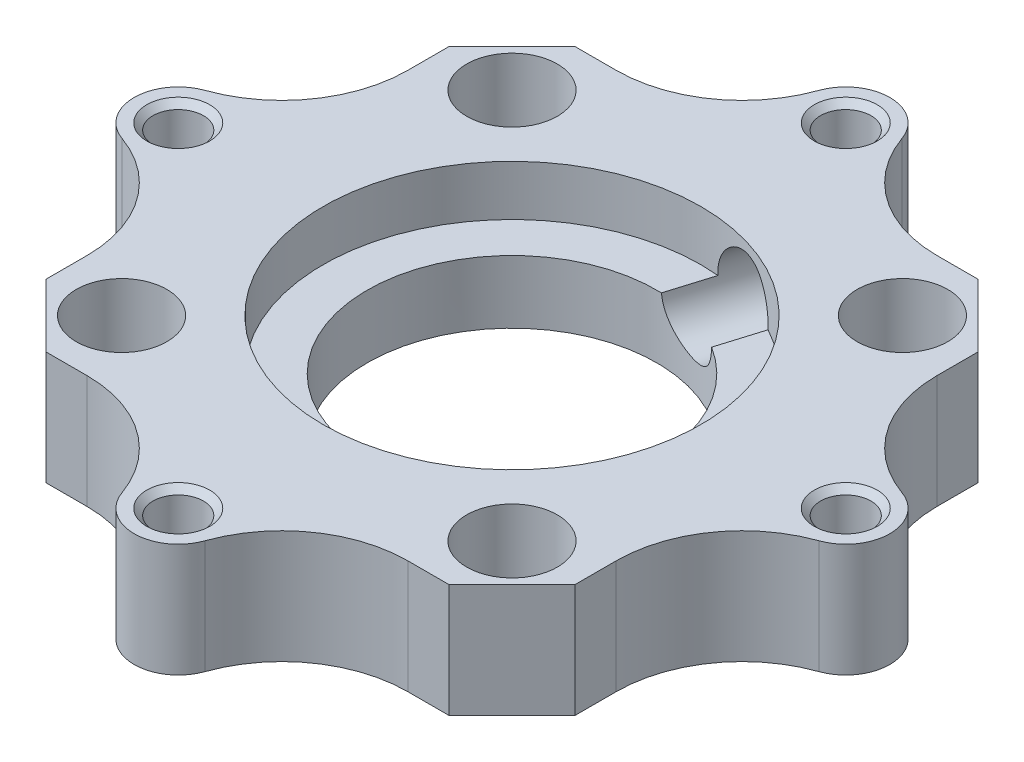
from build123d import *

# Parameters (mm, degrees)
SKETCH1_W               = 60
SKETCH1_H               = 60
SKETCH1_R               = 11.5
BOSS_EXTRUDE1_DEPTH     = 5
CUT_EXTRUDE1_DEPTH      = 10
SKETCH3_R               = 3.6
CUT_EXTRUDE2_DEPTH      = 3
SKETCH4_R               = 1.6
CUT_EXTRUDE3_DEPTH      = 3
SKETCH5_R               = 2
CUT_EXTRUDE4_DEPTH      = 43.720018727
CUT_EXTRUDE5_DEPTH      = 43.720018727
CHAMFER1_SIZE           = 5
FILLET1_R               = 10
BOSS_EXTRUDE2_START     = 4
SKETCH7_R               = 2
SKETCH7_R_2             = 3.6
SKETCH7_R_3             = 11.5
BOSS_EXTRUDE2_DEPTH     = 4
SKETCH8_R               = 15
CUT_EXTRUDE6_DEPTH      = 4
CUT_EXTRUDE7_DEPTH      = 10
CUT_EXTRUDE7_DEPTH_BACK = 16
SKETCH10_R              = 3
CHAMFER2_SIZE           = 0.5


with BuildPart() as part:
    # Sketch1 → Boss-Extrude1 (new body)
    with BuildSketch(Plane(origin=(0, 0, 0), x_dir=(1, 0, 0), z_dir=(0, 1, 0))):
        Rectangle(SKETCH1_W, SKETCH1_H)
        Circle(SKETCH1_R, mode=Mode.SUBTRACT)
    extrude(amount=BOSS_EXTRUDE1_DEPTH)

    # Sketch2 → Cut-Extrude1 (cut)
    with BuildSketch(Plane(origin=(0, 5, 0), x_dir=(1, 0, 0), z_dir=(0, 1, 0))):
        with BuildLine():
            Line((0, -30), (30, -30))
            Line((30, -30), (30, 0))
            ThreePointArc((30, 0), (21.213203436, -21.213203436), (0, -30))
        make_face()
        with BuildLine():
            Line((-30, -30), (0, -30))
            ThreePointArc((0, -30), (-21.213203436, -21.213203436), (-30, 0))
            Line((-30, 0), (-30, -30))
        make_face()
        with BuildLine():
            ThreePointArc((4.3e-08, 30), (21.213203451, 21.21320342), (30, 0))
            Line((30, 0), (30, 30))
            Line((30, 30), (4.3e-08, 30))
        make_face()
        with BuildLine():
            Line((-30, 30), (-30, 0))
            ThreePointArc((-30, 0), (-21.21320342, 21.213203451), (4.3e-08, 30))
            Line((4.3e-08, 30), (-30, 30))
        make_face()
    extrude(amount=-CUT_EXTRUDE1_DEPTH, mode=Mode.SUBTRACT)

    # Sketch3 → Cut-Extrude2 (cut)
    with BuildSketch(Plane(origin=(0, 5, 0), x_dir=(1, 0, 0), z_dir=(0, 1, 0))):
        with Locations((-15.5, 15.5)):
            Circle(SKETCH3_R)
        with Locations((15.5, 15.5)):
            Circle(SKETCH3_R)
        with Locations((15.5, -15.5)):
            Circle(SKETCH3_R)
        with Locations((-15.5, -15.5)):
            Circle(SKETCH3_R)
    extrude(amount=-CUT_EXTRUDE2_DEPTH, mode=Mode.SUBTRACT)

    # Sketch4 → Cut-Extrude3 (cut)
    with BuildSketch(Plane(origin=(0, 2, 0), x_dir=(1, 0, 0), z_dir=(0, 1, 0))):
        with Locations((-15.5, 15.5)):
            Circle(SKETCH4_R)
        with Locations((15.5, 15.5)):
            Circle(SKETCH4_R)
        with Locations((15.5, -15.5)):
            Circle(SKETCH4_R)
        with Locations((-15.5, -15.5)):
            Circle(SKETCH4_R)
    extrude(amount=-CUT_EXTRUDE3_DEPTH, mode=Mode.SUBTRACT)

    # Sketch5 → Cut-Extrude4 (cut, through all)
    with BuildSketch(Plane(origin=(0, 5, 0), x_dir=(1, 0, 0), z_dir=(0, 1, 0))):
        with Locations((-26.5, 0)):
            Circle(SKETCH5_R)
        with Locations((0, 26.5)):
            Circle(SKETCH5_R)
        with Locations((26.5, 0)):
            Circle(SKETCH5_R)
        with Locations((0, -26.5)):
            Circle(SKETCH5_R)
    extrude(amount=-CUT_EXTRUDE4_DEPTH, mode=Mode.SUBTRACT)

    # Sketch6 → Cut-Extrude5 (cut, through all)
    with BuildSketch(Plane(origin=(0, 5, 0), x_dir=(1, 0, 0), z_dir=(0, 1, 0))):
        with BuildLine():
            Line((3.5, 26.5), (3.5, 21))
            Line((3.5, 21), (21, 21))
            Line((21, 21), (21, 3.5))
            Line((21, 3.5), (26.5, 3.5))
            ThreePointArc((26.5, 3.5), (28.974873734, 2.474873734), (30, 0))
            ThreePointArc((30, 0), (21.213203434, 21.213203438), (-5e-09, 30))
            ThreePointArc((-5e-09, 30), (2.474873732, 28.974873736), (3.5, 26.5))
        make_face()
        with BuildLine():
            ThreePointArc((-3.5, 26.5), (-2.474873736, 28.974873732), (-5e-09, 30))
            ThreePointArc((-5e-09, 30), (-21.213203437, 21.213203434), (-30, 1e-09))
            ThreePointArc((-30, 1e-09), (-28.974873734, 2.474873735), (-26.5, 3.5))
            Line((-26.5, 3.5), (-21, 3.5))
            Line((-21, 3.5), (-21, 21))
            Line((-21, 21), (-3.5, 21))
            Line((-3.5, 21), (-3.5, 26.5))
        make_face()
        with BuildLine():
            ThreePointArc((0, -30), (21.213203436, -21.213203436), (30, 0))
            ThreePointArc((30, 0), (28.974873734, -2.474873734), (26.5, -3.5))
            Line((26.5, -3.5), (21, -3.5))
            Line((21, -3.5), (21, -21))
            Line((21, -21), (3.5, -21))
            Line((3.5, -21), (3.5, -26.5))
            ThreePointArc((3.5, -26.5), (2.474873734, -28.974873734), (0, -30))
        make_face()
        with BuildLine():
            ThreePointArc((-26.5, -3.5), (-28.974873735, -2.474873734), (-30, 1e-09))
            ThreePointArc((-30, 1e-09), (-21.213203436, -21.213203435), (0, -30))
            ThreePointArc((0, -30), (-2.474873734, -28.974873734), (-3.5, -26.5))
            Line((-3.5, -26.5), (-3.5, -21))
            Line((-3.5, -21), (-21, -21))
            Line((-21, -21), (-21, -3.5))
            Line((-21, -3.5), (-26.5, -3.5))
        make_face()
    extrude(amount=-CUT_EXTRUDE5_DEPTH, mode=Mode.SUBTRACT)

    # Chamfer1
    chamfer1_edges = [part.edges().sort_by_distance(p)[0] for p in [
        (-21, 2.5, -21),
        (-21, 2.5, 21),
        (21, 2.5, 21),
        (21, 2.5, -21),
    ]]
    chamfer(chamfer1_edges, length=CHAMFER1_SIZE)

    # Fillet1
    fillet1_edges = [part.edges().sort_by_distance(p)[0] for p in [
        (3.5, 2.5, -21),
        (-3.5, 2.5, -21),
        (-21, 2.5, -3.5),
        (-21, 2.5, 3.5),
        (-3.5, 2.5, 21),
        (3.5, 2.5, 21),
        (21, 2.5, 3.5),
        (21, 2.5, -3.5),
    ]]
    fillet(fillet1_edges, radius=FILLET1_R)

    # Sketch7 → Boss-Extrude2 (add)
    with BuildSketch(Plane(origin=(0, 5, 0), x_dir=(1, 0, 0), z_dir=(0, 1, 0)).offset(BOSS_EXTRUDE2_START)):
        with BuildLine():
            Line((-21, -12.727922061), (-21, -16))
            Line((-21, -16), (-16, -21))
            Line((-16, -21), (-12.727922061, -21))
            ThreePointArc((-12.727922061, -21), (-6.954419369, -22.835034191), (-3.299831646, -27.666666667))
            ThreePointArc((-3.299831646, -27.666666667), (0, -30), (3.299831646, -27.666666667))
            ThreePointArc((3.299831646, -27.666666667), (6.954419369, -22.835034191), (12.727922061, -21))
            Line((12.727922061, -21), (16, -21))
            Line((16, -21), (21, -16))
            Line((21, -16), (21, -12.727922061))
            ThreePointArc((21, -12.727922061), (22.835034191, -6.954419369), (27.666666667, -3.299831646))
            ThreePointArc((27.666666667, -3.299831646), (30, 0), (27.666666667, 3.299831646))
            ThreePointArc((27.666666667, 3.299831646), (22.835034191, 6.954419369), (21, 12.727922061))
            Line((21, 12.727922061), (21, 16))
            Line((21, 16), (16, 21))
            Line((16, 21), (12.727922061, 21))
            ThreePointArc((12.727922061, 21), (6.954419369, 22.835034191), (3.299831646, 27.666666667))
            ThreePointArc((3.299831646, 27.666666667), (0, 30), (-3.299831646, 27.666666667))
            ThreePointArc((-3.299831646, 27.666666667), (-6.954419369, 22.835034191), (-12.727922061, 21))
            Line((-12.727922061, 21), (-16, 21))
            Line((-16, 21), (-21, 16))
            Line((-21, 16), (-21, 12.727922061))
            ThreePointArc((-21, 12.727922061), (-22.835034191, 6.954419369), (-27.666666667, 3.299831646))
            ThreePointArc((-27.666666667, 3.299831646), (-30, 0), (-27.666666667, -3.299831646))
            ThreePointArc((-27.666666667, -3.299831646), (-22.835034191, -6.954419369), (-21, -12.727922061))
        make_face()
        with Locations((-26.5, 0)):
            Circle(SKETCH7_R, mode=Mode.SUBTRACT)
        with Locations((0, 26.5)):
            Circle(SKETCH7_R, mode=Mode.SUBTRACT)
        with Locations((26.5, 0)):
            Circle(SKETCH7_R, mode=Mode.SUBTRACT)
        with Locations((0, -26.5)):
            Circle(SKETCH7_R, mode=Mode.SUBTRACT)
        with Locations((-15.5, 15.5)):
            Circle(SKETCH7_R_2, mode=Mode.SUBTRACT)
        with Locations((15.5, 15.5)):
            Circle(SKETCH7_R_2, mode=Mode.SUBTRACT)
        with Locations((15.5, -15.5)):
            Circle(SKETCH7_R_2, mode=Mode.SUBTRACT)
        with Locations((-15.5, -15.5)):
            Circle(SKETCH7_R_2, mode=Mode.SUBTRACT)
        Circle(SKETCH7_R_3, mode=Mode.SUBTRACT)
    extrude(amount=-BOSS_EXTRUDE2_DEPTH)

    # Sketch8 → Cut-Extrude6 (cut)
    with BuildSketch(Plane(origin=(0, 9, 0), x_dir=(1, 0, 0), z_dir=(0, 1, 0))):
        Circle(SKETCH8_R)
    extrude(amount=-CUT_EXTRUDE6_DEPTH, mode=Mode.SUBTRACT)

    # Sketch10 → Cut-Extrude7 (cut, two sides: drawn at the far end of the back side and taken through both)
    with BuildSketch(Plane(origin=(6.806656618, 0, -22.349850985), x_dir=(-0.9566198787841765, 0, -0.29133899072205793), z_dir=(0.29133899072205793, 0, -0.9566198787841765)).offset(-CUT_EXTRUDE7_DEPTH_BACK)):
        with Locations((0, 5.23531916)):
            Circle(SKETCH10_R)
    extrude(amount=CUT_EXTRUDE7_DEPTH + CUT_EXTRUDE7_DEPTH_BACK, mode=Mode.SUBTRACT)

    # Chamfer2
    chamfer2_edges = [part.edges().sort_by_distance(p)[0] for p in [
        (-28.5, 9, 0),
        (-2, 9, -26.5),
        (24.5, 9, 0),
        (-2, 9, 26.5),
    ]]
    chamfer(chamfer2_edges, length=CHAMFER2_SIZE)


solid = part.part
